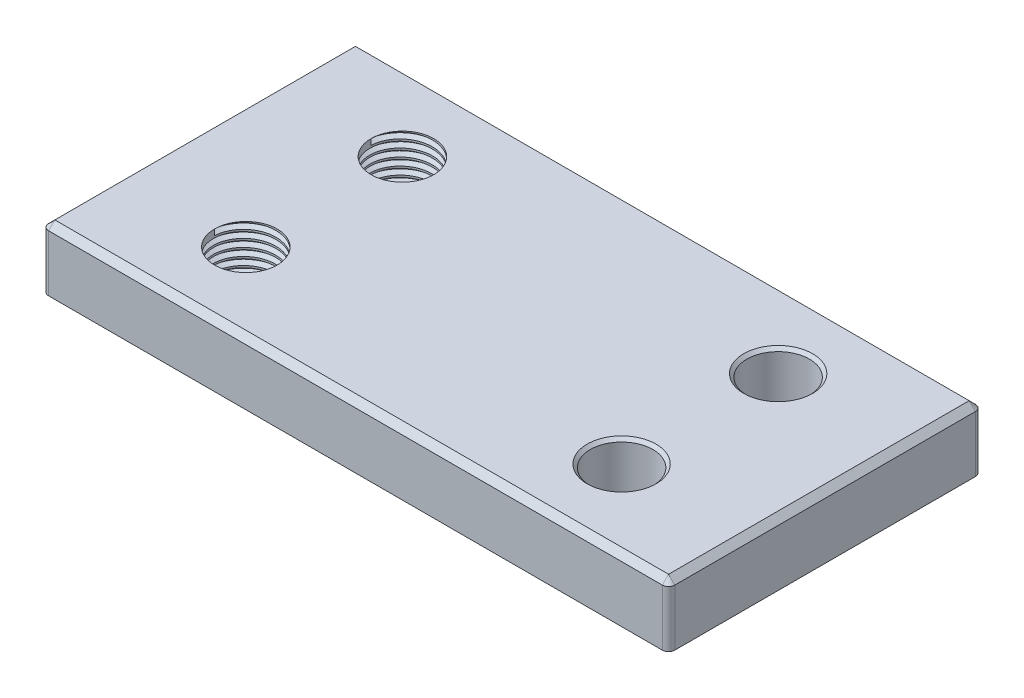
from build123d import *

# Parameters (mm, degrees)
SKETCH2_R           = 5
BOSS_EXTRUDE1_DEPTH = 5
CHAMFER1_SIZE       = 1
CHAMFER2_SIZE       = 0.5
THREAD1_PITCH       = 1.25
THREAD2_PITCH       = 1.25


with BuildPart() as part:
    # Sketch2 → Boss-Extrude1 (new, symmetric)
    with BuildSketch(Plane(origin=(0, 0, 0), x_dir=(1, 0, 0), z_dir=(0, 1, 0))):
        with BuildLine():
            Line((-50, 24), (-50, -24))
            ThreePointArc((-50, -24), (-49.707106781, -24.707106781), (-49, -25))
            Line((-49, -25), (49, -25))
            ThreePointArc((49, -25), (49.707106781, -24.707106781), (50, -24))
            Line((50, -24), (50, 24))
            ThreePointArc((50, 24), (49.707106781, 24.707106781), (49, 25))
            Line((49, 25), (-49, 25))
            ThreePointArc((-49, 25), (-49.707106781, 24.707106781), (-50, 24))
        make_face()
        with Locations(Location((30, 12.5, 0), (0, 0, 270))):
            Circle(SKETCH2_R, mode=Mode.SUBTRACT)
        with Locations(Location((30, -12.5, 0), (0, 0, 90))):
            Circle(SKETCH2_R, mode=Mode.SUBTRACT)
        with Locations(Location((-30, 12.5, 0), (0, 0, 270))):
            Circle(SKETCH2_R, mode=Mode.SUBTRACT)
        with Locations(Location((-30, -12.5, 0), (0, 0, 90))):
            Circle(SKETCH2_R, mode=Mode.SUBTRACT)
    extrude(amount=BOSS_EXTRUDE1_DEPTH, both=True)

    # Chamfer1
    chamfer1_edges = [part.edges().sort_by_distance(p)[0] for p in [
        (49.707106781, 5, 24.707106781),
        (50, 5, 0),
        (49.707106781, 5, -24.707106781),
        (0, 5, -25),
        (-49.707106781, 5, -24.707106781),
        (-50, 5, 0),
        (-49.707106781, 5, 24.707106781),
        (0, 5, 25),
    ]]
    chamfer(chamfer1_edges, length=CHAMFER1_SIZE)

    # Chamfer2
    chamfer2_edges = [part.edges().sort_by_distance(p)[0] for p in [
        (30, 5, -17.5),
        (30, 5, 17.5),
    ]]
    chamfer(chamfer2_edges, length=CHAMFER2_SIZE)

    # Thread1: the profile of Thread Profile2 profile screwed along a right-hand helix of 8 turns, 8 arcs to a turn; built about Z, then put on its axis
    thread1_z = Axis((0, 0, 0), (0, 0, 1))
    thread1_corners = [(4.9997, 0, -0.000173205), (5.676582344, 0, 0.390624998), (5.676582344, 0, 0.546874998), (4.9997, 0, 0.937673202)]
    with BuildLine(mode=Mode.PRIVATE) as thread1_profile:
        Line(thread1_corners[0], thread1_corners[1])
        Line(thread1_corners[1], thread1_corners[2])
        Line(thread1_corners[2], thread1_corners[3])
        Line(thread1_corners[3], thread1_corners[0])
    thread1_cap = Face(thread1_profile.wire())
    thread1_turn_angles = [0, 22.5, 45, 67.5, 90, 112.5, 135, 157.5, 180, 202.5, 225, 247.5, 270, 292.5, 315, 337.5, 360]
    thread1_turn_weights = [1, 0.9238795325112867, 1, 0.9238795325112867, 1, 0.9238795325112867, 1, 0.9238795325112867, 1, 0.9238795325112867, 1, 0.9238795325112867, 1, 0.9238795325112867, 1, 0.9238795325112867, 1]
    thread1_turn_rails = [Edge.make_bspline([Vector(p[0], p[1], 0).rotate(thread1_z, thread1_turn_angles[k]) / thread1_turn_weights[k] + Vector(0, 0, p[2] + THREAD1_PITCH * thread1_turn_angles[k] / 360) for k in range(17)], [0, 0, 0, 1, 1, 2, 2, 3, 3, 4, 4, 5, 5, 6, 6, 7, 7, 8, 8, 8], 2, thread1_turn_weights) for p in thread1_corners]
    thread1_turn_sides = [Face.make_surface_from_curves(thread1_turn_rails[p[0]], thread1_turn_rails[p[1]]) for p in [(0, 1), (1, 2), (2, 3), (3, 0)]]
    thread1 = Plane(origin=(-30, 5, -12.5), x_dir=(-1, 0, 0), z_dir=(0, -1, 0)) * Solid(Shell([*[p.moved(Location((0, 0, THREAD1_PITCH * i))) for i in range(8) for p in thread1_turn_sides], thread1_cap, thread1_cap.rotate(thread1_z, 2880).moved(Location((0, 0, THREAD1_PITCH * 2880 / 360)))]))
    add(thread1, mode=Mode.SUBTRACT)

    # Thread2: the profile of Thread Profile3 profile screwed along a right-hand helix of 8 turns, 8 arcs to a turn; built about Z, then put on its axis
    thread2_z = Axis((0, 0, 0), (0, 0, 1))
    thread2_corners = [(4.9997, 0, -0.000173205), (5.676582344, 0, 0.390624998), (5.676582344, 0, 0.546874998), (4.9997, 0, 0.937673202)]
    with BuildLine(mode=Mode.PRIVATE) as thread2_profile:
        Line(thread2_corners[0], thread2_corners[1])
        Line(thread2_corners[1], thread2_corners[2])
        Line(thread2_corners[2], thread2_corners[3])
        Line(thread2_corners[3], thread2_corners[0])
    thread2_cap = Face(thread2_profile.wire())
    thread2_turn_angles = [0, 22.5, 45, 67.5, 90, 112.5, 135, 157.5, 180, 202.5, 225, 247.5, 270, 292.5, 315, 337.5, 360]
    thread2_turn_weights = [1, 0.9238795325112867, 1, 0.9238795325112867, 1, 0.9238795325112867, 1, 0.9238795325112867, 1, 0.9238795325112867, 1, 0.9238795325112867, 1, 0.9238795325112867, 1, 0.9238795325112867, 1]
    thread2_turn_rails = [Edge.make_bspline([Vector(p[0], p[1], 0).rotate(thread2_z, thread2_turn_angles[k]) / thread2_turn_weights[k] + Vector(0, 0, p[2] + THREAD2_PITCH * thread2_turn_angles[k] / 360) for k in range(17)], [0, 0, 0, 1, 1, 2, 2, 3, 3, 4, 4, 5, 5, 6, 6, 7, 7, 8, 8, 8], 2, thread2_turn_weights) for p in thread2_corners]
    thread2_turn_sides = [Face.make_surface_from_curves(thread2_turn_rails[p[0]], thread2_turn_rails[p[1]]) for p in [(0, 1), (1, 2), (2, 3), (3, 0)]]
    thread2 = Plane(origin=(-30, 5, 12.5), x_dir=(-1, 0, 0), z_dir=(0, -1, 0)) * Solid(Shell([*[p.moved(Location((0, 0, THREAD2_PITCH * i))) for i in range(8) for p in thread2_turn_sides], thread2_cap, thread2_cap.rotate(thread2_z, 2880).moved(Location((0, 0, THREAD2_PITCH * 2880 / 360)))]))
    add(thread2, mode=Mode.SUBTRACT)


solid = part.part
